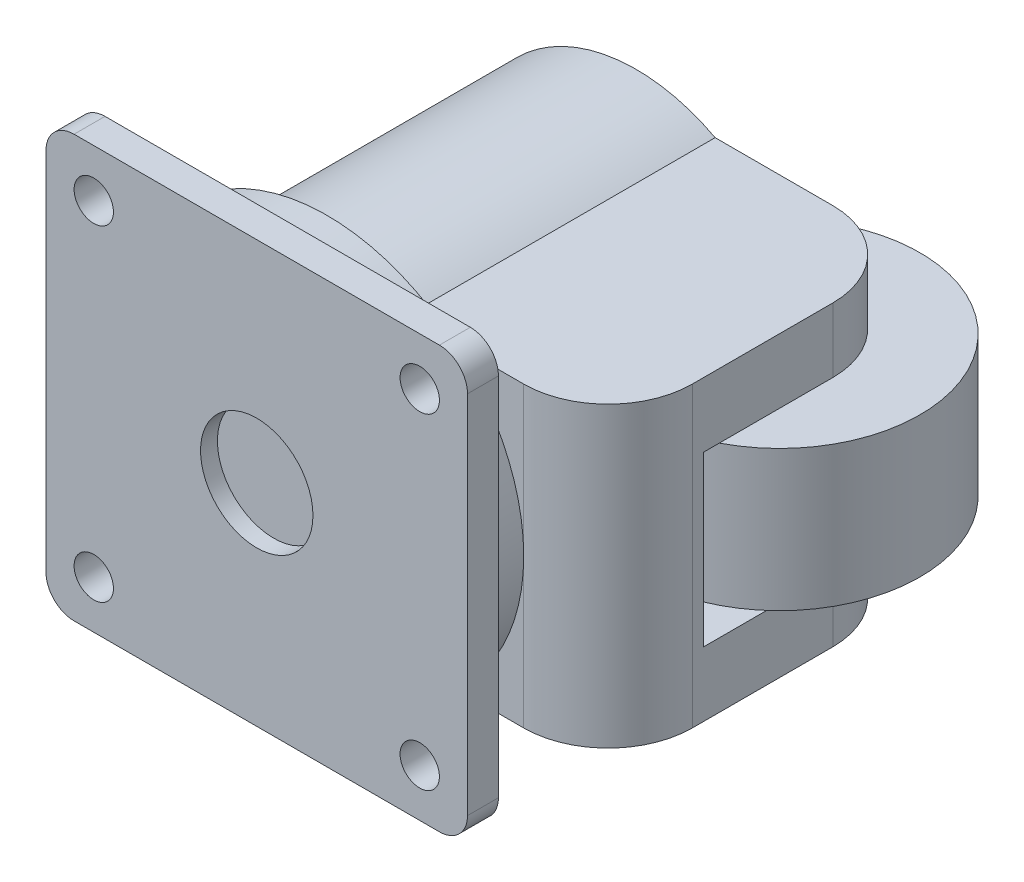
from build123d import *

# Parameters (mm, degrees)
SKETCH_1_W               = 75
SKETCH_1_H               = 75
EXTRUDE_1_DEPTH          = 5.5
FILLET_1_R               = 5
SKETCH_2_R               = 3.5
CUT_EXTRUDE_1_DEPTH      = 54.31744555
PATTERN_CIRCULAR_1_COUNT = 4
SKETCH_3_R               = 10
CUT_EXTRUDE_2_DEPTH      = 3
SKETCH_4_R               = 35
EXTRUDE_2_DEPTH          = 7
SKETCH_5_R               = 30
EXTRUDE_3_DEPTH          = 55
SKETCH_6_W               = 50
SKETCH_6_H               = 55
EXTRUDE_4_DEPTH          = 26.5
FILLET_2_R               = 15
SKETCH_7_W               = 38
SKETCH_7_H               = 30
CUT_EXTRUDE_3_DEPTH      = 114.606777967
SKETCH_9_R               = 25
EXTRUDE_5_DEPTH          = 12.5
EXTRUDE_6_REACH          = 118.916
SKETCH_8_R               = 2.5
FILLET_3_R               = 15


with BuildPart() as part:
    # 草图1 → 拉伸1 (new body)
    with BuildSketch(Plane.XY):
        Rectangle(SKETCH_1_W, SKETCH_1_H)
    extrude(amount=EXTRUDE_1_DEPTH)

    # 圆角1
    fillet_1_edges = [part.edges().sort_by_distance(p)[0] for p in [
        (-37.5, 37.5, 2.75),
        (37.5, 37.5, 2.75),
        (37.5, -37.5, 2.75),
        (-37.5, -37.5, 2.75),
    ]]
    fillet(fillet_1_edges, radius=FILLET_1_R)

    # 草图2 → 切除-拉伸1 (cut, through all)
    with BuildSketch(Plane.XY.offset(5.5)):
        with Locations((-29, 29)):
            Circle(SKETCH_2_R)
    cut_extrude_1 = extrude(amount=-CUT_EXTRUDE_1_DEPTH, mode=Mode.SUBTRACT)

    # 阵列(圆周)1: 切除-拉伸1 ×4 about axis
    pattern_circular_1_axis = Axis((0, 0, 0), (0, 0, 1))
    for i in range(1, PATTERN_CIRCULAR_1_COUNT):
        add(cut_extrude_1.rotate(pattern_circular_1_axis, i * 360 / PATTERN_CIRCULAR_1_COUNT), mode=Mode.SUBTRACT)

    # 草图3 → 切除-拉伸2 (cut)
    with BuildSketch(Plane.XY.offset(5.5)):
        Circle(SKETCH_3_R)
    extrude(amount=-CUT_EXTRUDE_2_DEPTH, mode=Mode.SUBTRACT)

    # 草图4 → 拉伸2 (add)
    with BuildSketch(Plane(origin=(0, 0, 0), x_dir=(-1, 0, 0), z_dir=(0, 0, -1))):
        with Locations(Location((0, 0, 0), (0, 0, 180))):
            Circle(SKETCH_4_R)
    extrude(amount=EXTRUDE_2_DEPTH)

    # 草图5 → 拉伸3 (add)
    with BuildSketch(Plane(origin=(0, 0, -7), x_dir=(-1, 0, 0), z_dir=(0, 0, -1))):
        Circle(SKETCH_5_R)
    extrude(amount=EXTRUDE_3_DEPTH)

    # 草图6 → 拉伸4 (add, symmetric)
    with BuildSketch(Plane(origin=(0, 0, 0), x_dir=(1, 0, 0), z_dir=(0, 1, 0))):
        with Locations((25, 34.5)):
            Rectangle(SKETCH_6_W, SKETCH_6_H)
    extrude(amount=EXTRUDE_4_DEPTH, both=True)

    # 圆角2
    fillet_2_edges = [part.edges().sort_by_distance(p)[0] for p in [
        (50, 0, -7),
    ]]
    fillet(fillet_2_edges, radius=FILLET_2_R - 0.0001)  # a hair under: the kernel refuses the full size

    # 草图7 → 切除-拉伸3 (cut, through all)
    with BuildSketch(Plane(origin=(50, 0, 0), x_dir=(0, 0, -1), z_dir=(1, 0, 0))):
        with Locations((43, 0)):
            Rectangle(SKETCH_7_W, SKETCH_7_H)
    extrude(amount=-CUT_EXTRUDE_3_DEPTH, mode=Mode.SUBTRACT)

    # 拉伸6: up to this face of the body (flat: up to its plane)
    extrude_6_end = Plane(part.part.faces().sort_by_distance((31.665133936, -26.5, -35.104709871))[0])
    # 草图8 → 拉伸6 (add, up to the picked face)
    with BuildSketch(Plane(origin=(0, 26.5, 0), x_dir=(1, 0, 0), z_dir=(0, 1, 0)), mode=Mode.PRIVATE) as extrude_6_sk1:
        with Locations(Location((36, 51.5, 0), (0, 0, 270))):
            Circle(SKETCH_8_R)
    extrude_6_tool1 = split(extrude(extrude_6_sk1.sketch, amount=-EXTRUDE_6_REACH, mode=Mode.PRIVATE), bisect_by=extrude_6_end, keep=Keep.BOTH, mode=Mode.PRIVATE)


with BuildPart() as body_2:
    # 草图9 → 拉伸5 (new, symmetric)
    with BuildSketch(Plane(origin=(0, 0, 0), x_dir=(1, 0, 0), z_dir=(0, 1, 0))):
        with Locations(Location((36, 51.5, 0), (0, 0, 270))):
            Circle(SKETCH_9_R)
    extrude(amount=EXTRUDE_5_DEPTH, both=True)


with BuildPart() as part_1:
    add(part.part)

    add(body_2.part)  # 拉伸6 merges body 2
    add(extrude_6_tool1.solids().sort_by(Axis((36, 26.5, -51.5), (0, -1, 0)))[0])

    # 圆角3
    fillet_3_edges = [part_1.edges().sort_by_distance(p)[0] for p in [
        (50, 20.75, -62),
        (50, -20.75, -62),
    ]]
    fillet(fillet_3_edges, radius=FILLET_3_R)


solid = part_1.part
